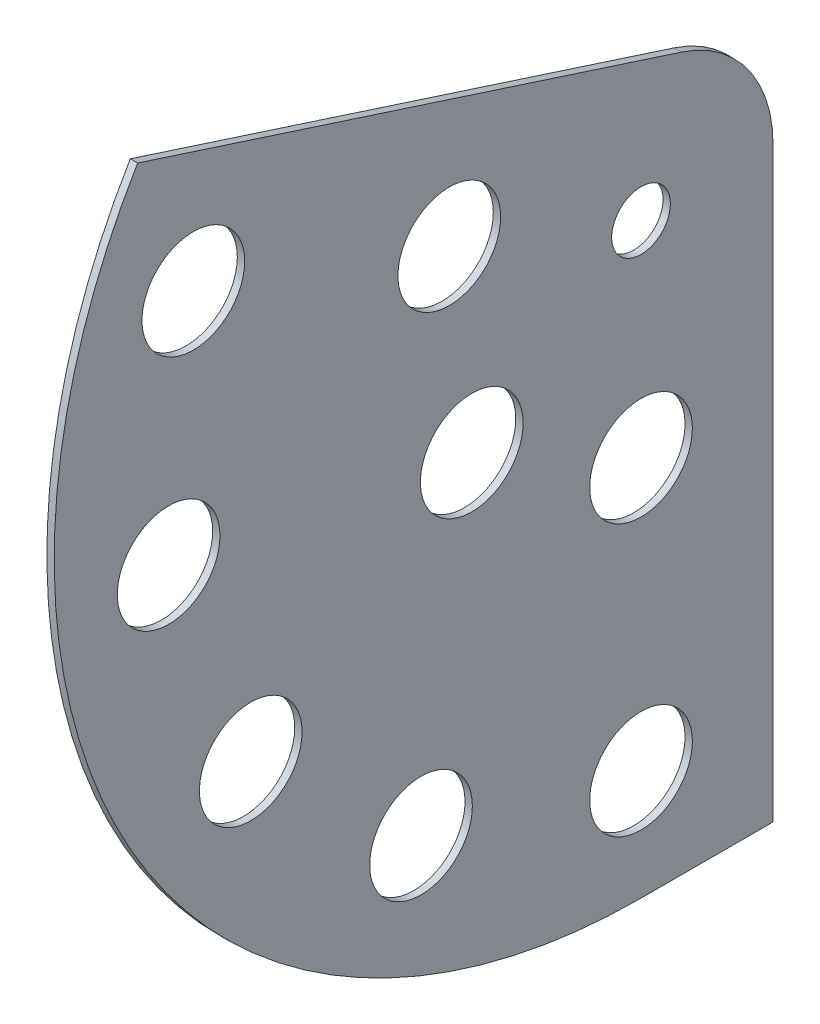
from build123d import *

# Parameters (mm, degrees)
SKETCH1_R           = 12.7
SKETCH1_R_2         = 22.225
BOSS_EXTRUDE1_DEPTH = 3.175


with BuildPart() as part:
    # Sketch1 → Boss-Extrude1 (new body)
    with BuildSketch(Plane(origin=(0, 0, 0), x_dir=(0, 0, -1), z_dir=(1, 0, 0))):
        with BuildLine():
            Line((-217.899389282, 130.521477737), (17.58316119, 54.3778902))
            ThreePointArc((17.58316119, 54.3778902), (46.211471314, 33.624729277), (57.15, 0))
            Line((57.15, 0), (57.15, -254))
            Line((57.15, -254), (0, -254))
            ThreePointArc((0, -254), (-220.984677461, -125.226883405), (-217.899389282, 130.521477737))
        make_face()
        Circle(SKETCH1_R, mode=Mode.SUBTRACT)
        with Locations((0, -88.9)):
            Circle(SKETCH1_R_2, mode=Mode.SUBTRACT)
        with Locations((-73.264818168, -50.353514463)):
            Circle(SKETCH1_R_2, mode=Mode.SUBTRACT)
        with Locations((-82.995299916, 31.858910715)):
            Circle(SKETCH1_R_2, mode=Mode.SUBTRACT)
        with Locations((0, -206.230462898)):
            Circle(SKETCH1_R_2, mode=Mode.SUBTRACT)
        with Locations((-95.22663025, -182.928654722)):
            Circle(SKETCH1_R_2, mode=Mode.SUBTRACT)
        with Locations((-168.934105277, -118.288933976)):
            Circle(SKETCH1_R_2, mode=Mode.SUBTRACT)
        with Locations((-204.466132699, -26.918477042)):
            Circle(SKETCH1_R_2, mode=Mode.SUBTRACT)
        with Locations((-193.793244166, 70.534972478)):
            Circle(SKETCH1_R_2, mode=Mode.SUBTRACT)
    extrude(amount=BOSS_EXTRUDE1_DEPTH)


solid = part.part
